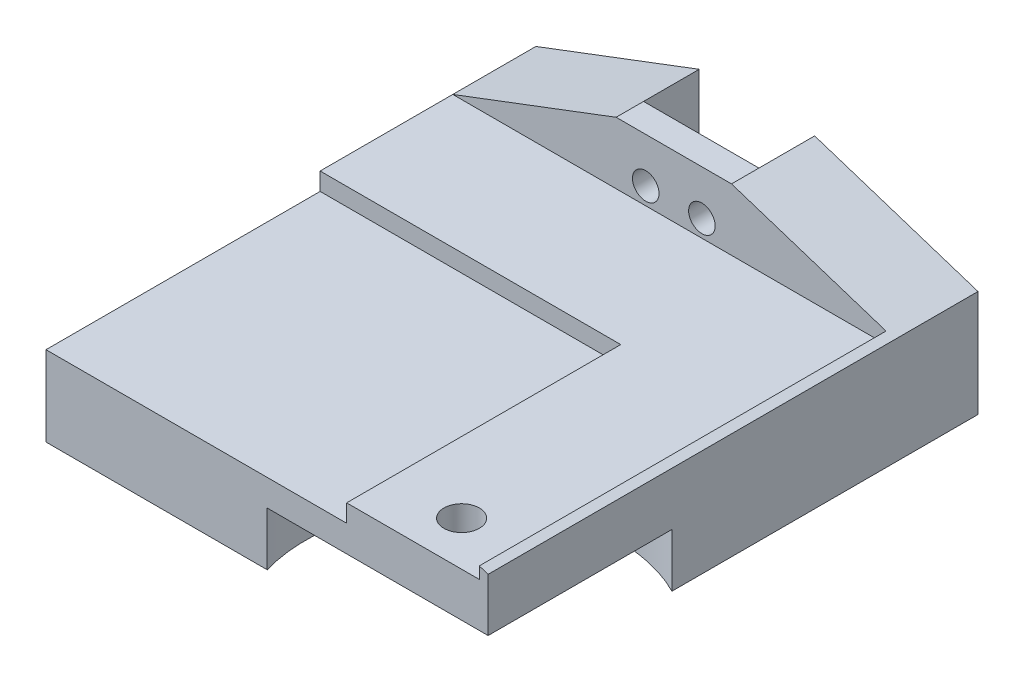
from build123d import *

# Parameters (mm, degrees)
OUTLINESKETCH2_W                           = 50
OUTLINESKETCH2_H                           = 55.4
OUTLINESKETCH2_R                           = 2
OUTLINEBOSS_EXTRUDE1_DEPTH                 = 18.05
BUILDPLATECUTOUTSKETCH1_W                  = 49
BUILDPLATECUTOUTSKETCH1_H                  = 46
BUILDPLATECUTOUTCUT_EXTRUDE7_DEPTH         = 7
MICROSWITCHSKETCH9_W                       = 13.05
MICROSWITCHSKETCH9_H                       = 12.05
MICROSWITCHCUT_EXTRUDE6_DEPTH              = 6.3
MICROSWITCHMOUNTINGHOLESSKETCH10_R         = 1.5
MICROSWITCHMOUNTINGHOLESCUT_EXTRUDE4_DEPTH = 3.1
CABLECUTCUT_EXTRUDE5_DEPTH                 = 76.59340249
HEATMATCUTSKETCH3_W                        = 34
HEATMATCUTSKETCH3_H                        = 31
HEATMATCUT_EXTRUDE8_DEPTH                  = 2
BALLJOINTCUT_EXTRUDE9_DEPTH                = 6.05
CHAMFER1_SIZE                              = 7
CHAMFER1_SIZE2                             = 18.475
CHAMFER2_SIZE                              = 6
CHAMFER2_SIZE2                             = 18.475


with BuildPart() as part:
    # OutlineSketch2 → OutlineBoss-Extrude1 (new body)
    with BuildSketch(Plane(origin=(0, 0, 0), x_dir=(1, 0, 0), z_dir=(0, 1, 0))):
        with Locations((25, 27.7)):
            Rectangle(OUTLINESKETCH2_W, OUTLINESKETCH2_H)
        with Locations((42, 5)):
            Circle(OUTLINESKETCH2_R, mode=Mode.SUBTRACT)
    extrude(amount=OUTLINEBOSS_EXTRUDE1_DEPTH)

    # BuildPlateCutoutSketch1 → BuildPlateCutoutCut-Extrude7 (cut)
    with BuildSketch(Plane(origin=(0, 18.05, 0), x_dir=(1, 0, 0), z_dir=(0, 1, 0))):
        with Locations((24.5, 23)):
            Rectangle(BUILDPLATECUTOUTSKETCH1_W, BUILDPLATECUTOUTSKETCH1_H)
    extrude(amount=-BUILDPLATECUTOUTCUT_EXTRUDE7_DEPTH, mode=Mode.SUBTRACT)

    # MicroSwitchSketch9 → MicroSwitchCut-Extrude6 (cut)
    with BuildSketch(Plane(origin=(0, 0, -55.4), x_dir=(-1, 0, 0), z_dir=(0, 0, -1))):
        with Locations((-25, 12.025)):
            Rectangle(MICROSWITCHSKETCH9_W, MICROSWITCHSKETCH9_H)
    extrude(amount=-MICROSWITCHCUT_EXTRUDE6_DEPTH, mode=Mode.SUBTRACT)

    # MicroSwitchMountingHolesSketch10 → MicroSwitchMountingHolesCut-Extrude4 (cut)
    with BuildSketch(Plane(origin=(0, 0, -49.1), x_dir=(-1, 0, 0), z_dir=(0, 0, -1))):
        with Locations((-28.175, 13)):
            Circle(MICROSWITCHMOUNTINGHOLESSKETCH10_R)
        with Locations((-21.825, 13)):
            Circle(MICROSWITCHMOUNTINGHOLESSKETCH10_R)
    extrude(amount=-MICROSWITCHMOUNTINGHOLESCUT_EXTRUDE4_DEPTH, mode=Mode.SUBTRACT)

    # CableCutSketch11 → CableCutCut-Extrude5 (cut, through all)
    with BuildSketch(Plane(origin=(0, 6, 0), x_dir=(1, 0, 0), z_dir=(0, 1, 0))):
        Polygon((24.125, 55.4), (24.125, 53.65), (23.125, 53.65), (23.125, 51.9), (26.875, 51.9), (26.875, 53.65), (25.875, 53.65), (25.875, 55.4), align=None)
    extrude(amount=-CABLECUTCUT_EXTRUDE5_DEPTH, mode=Mode.SUBTRACT)

    # HeatMatCutSketch3 → HeatMatCut-Extrude8 (cut)
    with BuildSketch(Plane(origin=(0, 11.05, 0), x_dir=(1, 0, 0), z_dir=(0, 1, 0))):
        with Locations((17, 15.5)):
            Rectangle(HEATMATCUTSKETCH3_W, HEATMATCUTSKETCH3_H)
    extrude(amount=-HEATMATCUT_EXTRUDE8_DEPTH, mode=Mode.SUBTRACT)

    # BallJointCutoutSketch4 → BallJointCut-Extrude9 (cut)
    with BuildSketch(Plane.XZ):
        with BuildLine():
            Line((25.020895194, 0), (50, 0))
            Line((50, 0), (50, -20.788920166))
            ThreePointArc((50, -20.788920166), (30.677417203, -18.604746187), (25.020895194, 0))
        make_face()
    extrude(amount=-BALLJOINTCUT_EXTRUDE9_DEPTH, mode=Mode.SUBTRACT)

    # Chamfer1
    chamfer1_edges = [part.edges().sort_by_distance(p)[0] for p in [
        (0, 18.05, -50.7),
    ]]
    chamfer1_side = [part.faces().sort_by_distance(p)[0] for p in [
        (0, 6.03362055, -31.38491972),
    ]]
    chamfer(chamfer1_edges, length=CHAMFER1_SIZE, length2=CHAMFER1_SIZE2, reference=chamfer1_side[0])

    # Chamfer2
    chamfer2_edges = [part.edges().sort_by_distance(p)[0] for p in [
        (50, 18.05, -27.7),
    ]]
    chamfer2_side = [part.faces().sort_by_distance(p)[0] for p in [
        (50, 9.888235373, -30.189792368),
    ]]
    chamfer(chamfer2_edges, length=CHAMFER2_SIZE, length2=CHAMFER2_SIZE2, reference=chamfer2_side[0])


solid = part.part
